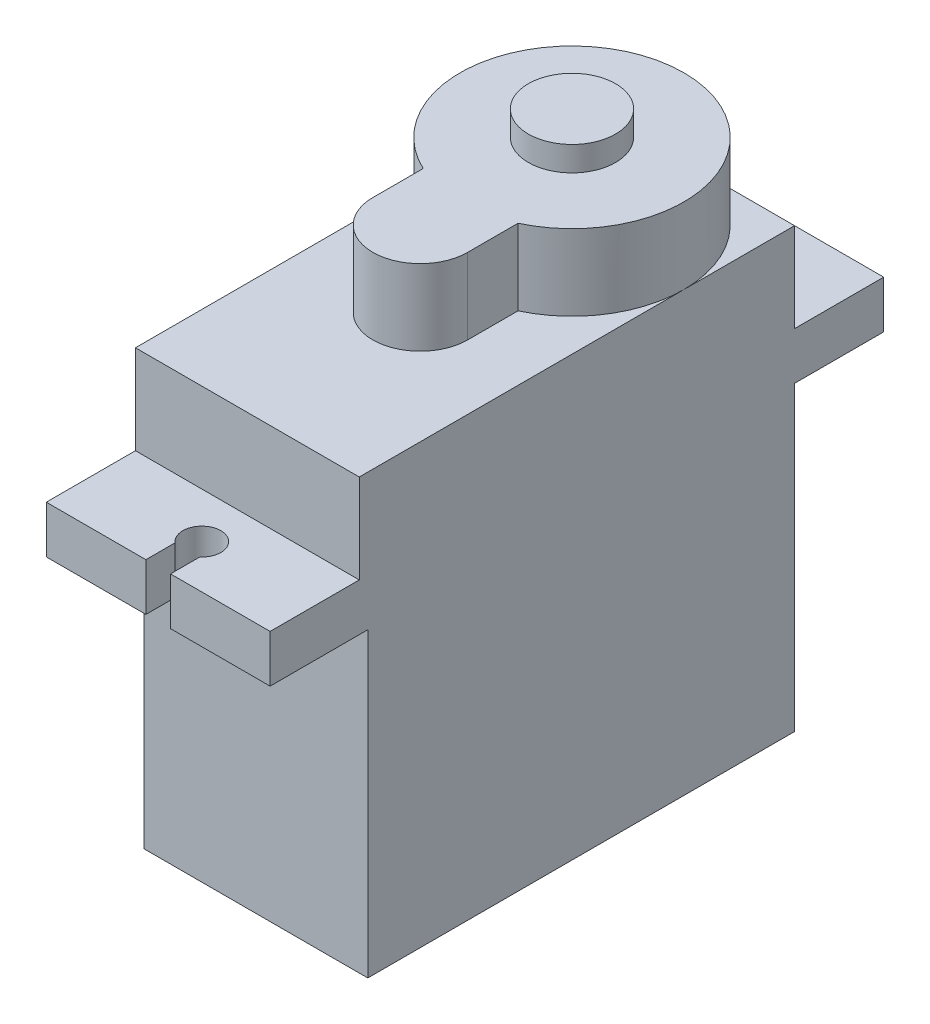
from build123d import *

# Parameters (mm, degrees)
BOSS_EXTRUDE1_DEPTH   = 11.8
BOSS_EXTRUDE2_DEPTH   = 4
SKETCH4_R             = 2.3
BOSS_EXTRUDE3_DEPTH   = 3.2
SKETCH5_R             = 0.85
CUT_EXTRUDE1_DEPTH    = 1
CUT_EXTRUDE2_DEPTH    = 10
MOVER_START           = 28.4
MOVER_FACE2_OUTLINE_R = 2.3
MOVER_FACE2_DEPTH     = 1.9


# Read off the part's stored shape, not the designer's step: Mover face2
with BuildPart() as part:
    # Sketch2 → Boss-Extrude1 (new body)
    with BuildSketch(Plane(origin=(0, 0, 0), x_dir=(0, 0, -1), z_dir=(1, 0, 0))):
        Polygon((7.432291728, 0), (29.932291728, 0), (29.932291728, 15.9), (34.632291728, 15.9), (34.632291728, 18.4), (29.932291728, 18.4), (29.932291728, 23.1), (6.982957442, 23.1), (6.982957442, 18.4), (2.282957442, 18.4), (2.282957442, 15.9), (7.432291728, 15.9), align=None)
    extrude(amount=BOSS_EXTRUDE1_DEPTH)

    # Sketch3 → Boss-Extrude2 (add)
    with BuildSketch(Plane(origin=(0, 23.1, 0), x_dir=(-1, 0, 0), z_dir=(0, 1, 0))):
        with BuildLine():
            Line((-3.4, -16.098037438), (-3.4, -18.753881751))
            ThreePointArc((-3.4, -18.753881751), (-5.9, -29.998037438), (-8.4, -18.753881751))
            Line((-8.4, -18.753881751), (-8.4, -16.098037438))
            ThreePointArc((-8.4, -16.098037438), (-5.9, -13.598037438), (-3.4, -16.098037438))
        make_face()
    extrude(amount=BOSS_EXTRUDE2_DEPTH)

    # Sketch4 → Boss-Extrude3 (add)
    with BuildSketch(Plane(origin=(0, 27.1, 0), x_dir=(-1, 0, 0), z_dir=(0, 1, 0))):
        with Locations(Location((-5.9, -24.098037438, 0), (0, 0, 90))):
            Circle(SKETCH4_R)
    extrude(amount=BOSS_EXTRUDE3_DEPTH)

    # Sketch5 → Cut-Extrude1 (cut)
    with BuildSketch(Plane(origin=(0, 30.3, 0), x_dir=(1, 0, 0), z_dir=(0, 1, 0))):
        with Locations(Location((5.9, 24.098037438, 0), (0, 0, 270))):
            Circle(SKETCH5_R)
    extrude(amount=-CUT_EXTRUDE1_DEPTH, mode=Mode.SUBTRACT)

    # Sketch6 → Cut-Extrude2 (cut)
    with BuildSketch(Plane(origin=(0, 18.4, 0), x_dir=(1, 0, 0), z_dir=(0, 1, 0))):
        with BuildLine():
            Line((6.55, 2.282957442), (5.25, 2.282957442))
            Line((5.25, 2.282957442), (5.25, 3.823023234))
            ThreePointArc((5.25, 3.823023234), (5.9, 5.582957442), (6.55, 3.823023234))
            Line((6.55, 3.823023234), (6.55, 2.282957442))
        make_face()
        with BuildLine():
            Line((6.55, 34.632291728), (5.25, 34.632291728))
            Line((5.25, 34.632291728), (5.25, 33.092225935))
            ThreePointArc((5.25, 33.092225935), (5.9, 31.332291728), (6.55, 33.092225935))
            Line((6.55, 33.092225935), (6.55, 34.632291728))
        make_face()
    extrude(amount=-CUT_EXTRUDE2_DEPTH, mode=Mode.SUBTRACT)

    # Mover face2 outline → Mover face2 (cut)
    with BuildSketch(Plane(origin=(0, 0, 0), x_dir=(1, 0, 0), z_dir=(0, 1, 0)).offset(MOVER_START)):
        with Locations((5.9, 24.098037438)):
            Circle(MOVER_FACE2_OUTLINE_R)
    extrude(amount=MOVER_FACE2_DEPTH, mode=Mode.SUBTRACT)


solid = part.part
